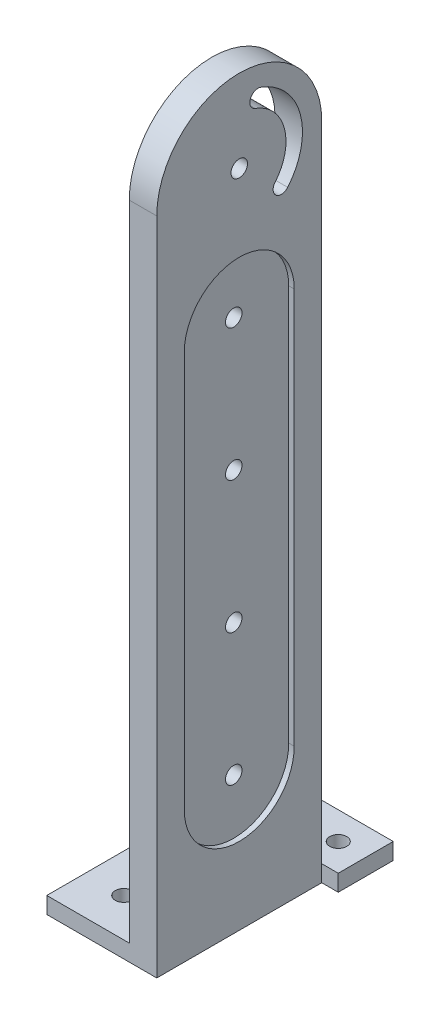
from build123d import *

# Parameters (mm, degrees)
SKETCH_1_R          = 1.5
EXTRUDE_2_DEPTH     = 5
EXTRUDE_3_DEPTH     = 3
SKETCH_6_R          = 1.55
CUT_EXTRUDE_2_DEPTH = 10
SKETCH_7_W          = 3
SKETCH_7_H          = 41
EXTRUDE_4_DEPTH     = 13
EXTRUDE_5_DEPTH     = 3
SKETCH_10_R         = 1.6
CUT_EXTRUDE_3_DEPTH = 3
CUT_EXTRUDE_5_DEPTH = 1


with BuildPart() as part:
    # 草图1 → 凸台-拉伸2 (new body)
    with BuildSketch(Plane(origin=(0, 0, 0), x_dir=(0, 0, -1), z_dir=(1, 0, 0))):
        with BuildLine():
            Line((-15, 0), (15, 0))
            Line((15, 0), (15, 120))
            ThreePointArc((15, 120), (0, 135), (-15, 120))
            Line((-15, 120), (-15, 0))
        make_face()
        with Locations((0, 24)):
            Circle(SKETCH_1_R, mode=Mode.SUBTRACT)
        with Locations((0, 48)):
            Circle(SKETCH_1_R, mode=Mode.SUBTRACT)
        with Locations((0, 72)):
            Circle(SKETCH_1_R, mode=Mode.SUBTRACT)
        with Locations((0, 96)):
            Circle(SKETCH_1_R, mode=Mode.SUBTRACT)
        with Locations((0, 120)):
            Circle(SKETCH_1_R, mode=Mode.SUBTRACT)
        with BuildLine():
            ThreePointArc((2.907171218, 127.987387277), (2.010662502, 129.909956423), (3.933231648, 130.806465139))
            ThreePointArc((3.933231648, 130.806465139), (11.108147002, 122.976419019), (8.809511096, 112.607942489))
            ThreePointArc((8.809511096, 112.607942489), (6.696263017, 112.423057238), (6.511377767, 114.536305318))
            ThreePointArc((6.511377767, 114.536305318), (8.210369523, 122.199961883), (2.907171218, 127.987387277))
        make_face(mode=Mode.SUBTRACT)
    extrude(amount=-EXTRUDE_2_DEPTH)

    # 草图5 → 凸台-拉伸3 (add)
    with BuildSketch(Plane(origin=(0, 0, 0), x_dir=(-1, 0, 0), z_dir=(0, -1, 0))):
        Polygon((0, -15), (20, -15), (20, 15), (20, 25), (-3, 25), (-3, 15), (0, 15), align=None)
    extrude(amount=-EXTRUDE_3_DEPTH)

    # 草图6 → 切除-拉伸2 (cut)
    with BuildSketch(Plane.XZ):
        with Locations((-13, 8)):
            Circle(SKETCH_6_R)
        with Locations((-2, -20)):
            Circle(SKETCH_6_R)
        with Locations((-13, -3)):
            Circle(SKETCH_6_R)
    extrude(amount=-CUT_EXTRUDE_2_DEPTH, mode=Mode.SUBTRACT)

    # 草图7 → 凸台-拉伸4 (add)
    with BuildSketch(Plane.ZY.offset(5)):
        with Locations((-10.3, 23.5)):
            Rectangle(SKETCH_7_W, SKETCH_7_H)
    extrude(amount=EXTRUDE_4_DEPTH)

    # 草图9 → 凸台-拉伸5 (add)
    with BuildSketch(Plane(origin=(0, 0, -11.8), x_dir=(-1, 0, 0), z_dir=(0, 0, -1))):
        Polygon((18, 50.5), (5, 63.5), (5, 50.5), (5, 44), (18, 44), align=None)
    extrude(amount=-EXTRUDE_5_DEPTH)

    # 草图10 → 切除-拉伸3 (cut)
    with BuildSketch(Plane(origin=(0, 0, -11.8), x_dir=(-1, 0, 0), z_dir=(0, 0, -1))):
        with Locations((11.5, 44)):
            Circle(SKETCH_10_R)
        with Locations((11.5, 7)):
            Circle(SKETCH_10_R)
    extrude(amount=-CUT_EXTRUDE_3_DEPTH, mode=Mode.SUBTRACT)

    # 草图12 → 切除-拉伸5 (cut)
    with BuildSketch(Plane(origin=(0, 0, 0), x_dir=(0, 0, -1), z_dir=(1, 0, 0))):
        with BuildLine():
            Line((-10, 24), (-10, 96))
            ThreePointArc((-10, 96), (0, 106), (10, 96))
            Line((10, 96), (10, 24))
            ThreePointArc((10, 24), (0, 14), (-10, 24))
        make_face()
    extrude(amount=-CUT_EXTRUDE_5_DEPTH, mode=Mode.SUBTRACT)


solid = part.part
